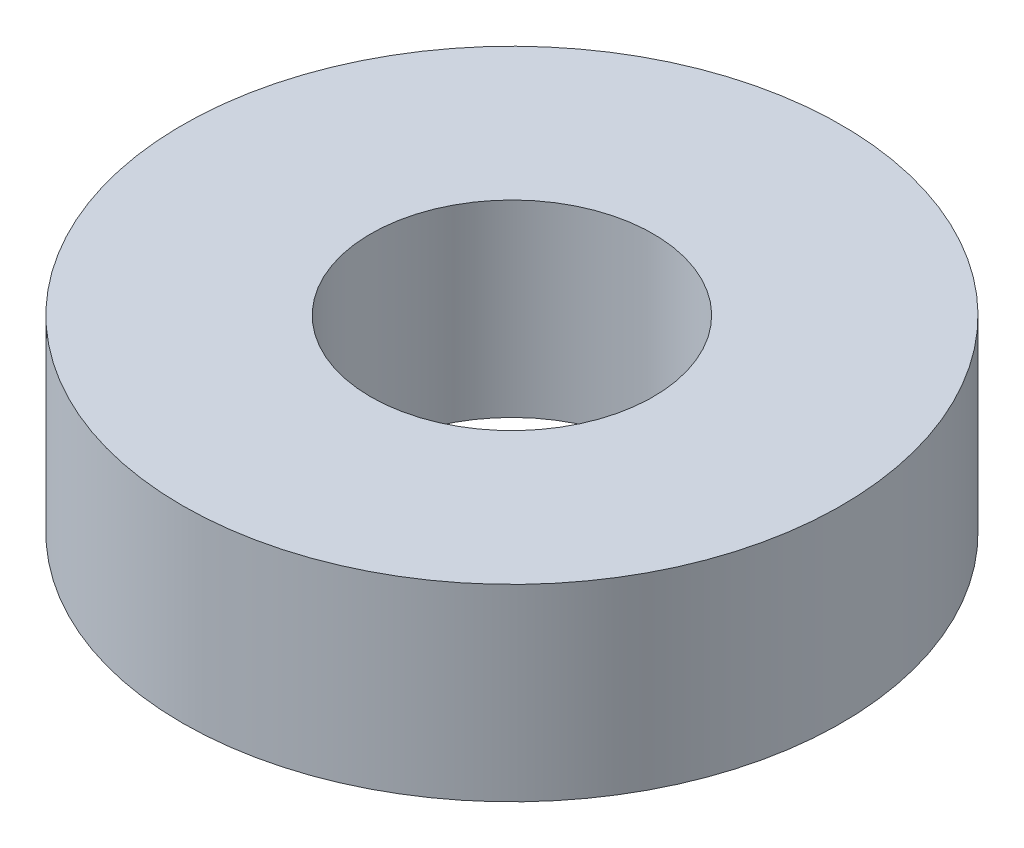
from build123d import *

# Parameters (mm, degrees)
SKETCH1_R           = 52.5
BOSS_EXTRUDE1_DEPTH = 30
SKETCH2_R           = 22.5
CUT_EXTRUDE1_DEPTH  = 81.07808689


with BuildPart() as part:
    # Sketch1 → Boss-Extrude1 (new body)
    with BuildSketch(Plane(origin=(0, 0, 0), x_dir=(1, 0, 0), z_dir=(0, 1, 0))):
        Circle(SKETCH1_R)
    extrude(amount=BOSS_EXTRUDE1_DEPTH)

    # Sketch2 → Cut-Extrude1 (cut, through all)
    with BuildSketch(Plane(origin=(0, 0, 0), x_dir=(1, 0, 0), z_dir=(0, 1, 0))):
        Circle(SKETCH2_R)
    extrude(amount=CUT_EXTRUDE1_DEPTH, mode=Mode.SUBTRACT)


solid = part.part
